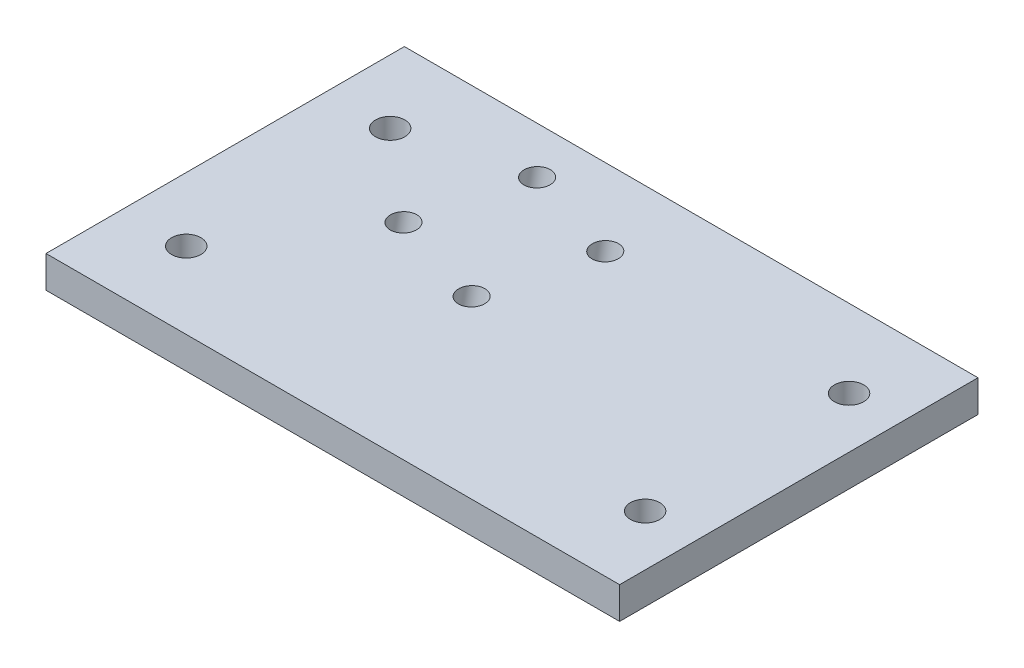
from build123d import *

# Parameters (mm, degrees)
SKETCH1_W           = 90
SKETCH1_H           = 56.23
BOSS_EXTRUDE1_DEPTH = 5
SKETCH2_R           = 2.3
CUT_EXTRUDE1_DEPTH  = 15
SKETCH6_R           = 2.03980448
CUT_EXTRUDE2_DEPTH  = 45
SKETCH7_R           = 2.3
CUT_EXTRUDE3_DEPTH  = 45


with BuildPart() as part:
    # Sketch1 → Boss-Extrude1 (new body)
    with BuildSketch(Plane(origin=(0, 0, 0), x_dir=(1, 0, 0), z_dir=(0, 1, 0))):
        with Locations((45, 28.115)):
            Rectangle(SKETCH1_W, SKETCH1_H)
    extrude(amount=BOSS_EXTRUDE1_DEPTH)

    # Sketch2 → Cut-Extrude1 (cut)
    with BuildSketch(Plane(origin=(0, 5, 0), x_dir=(1, 0, 0), z_dir=(0, 1, 0))):
        with Locations((82, 12)):
            Circle(SKETCH2_R)
        with Locations((10, 12)):
            Circle(SKETCH2_R)
    extrude(amount=-CUT_EXTRUDE1_DEPTH, mode=Mode.SUBTRACT)

    # Sketch6 → Cut-Extrude2 (cut)
    with BuildSketch(Plane(origin=(0, 15.35002401, -2.983742412), x_dir=(-1, 0, 0), z_dir=(0, 0.9816271834476639, -0.19080899537654525))):
        with Locations((-28.177489427, -47.024296281)):
            Circle(SKETCH6_R)
        with Locations((-23.817578468, -30.72582752)):
            Circle(SKETCH6_R)
        with Locations((-39.212096207, -26.109906854)):
            Circle(SKETCH6_R)
        with Locations((-43.572007167, -42.408375615)):
            Circle(SKETCH6_R)
    extrude(amount=-CUT_EXTRUDE2_DEPTH, mode=Mode.SUBTRACT)

    # Sketch7 → Cut-Extrude3 (cut)
    with BuildSketch(Plane(origin=(0, 5, 0), x_dir=(1, 0, 0), z_dir=(0, 1, 0))):
        with Locations((82, 44)):
            Circle(SKETCH7_R)
        with Locations((10, 44)):
            Circle(SKETCH7_R)
    extrude(amount=-CUT_EXTRUDE3_DEPTH, mode=Mode.SUBTRACT)


solid = part.part
